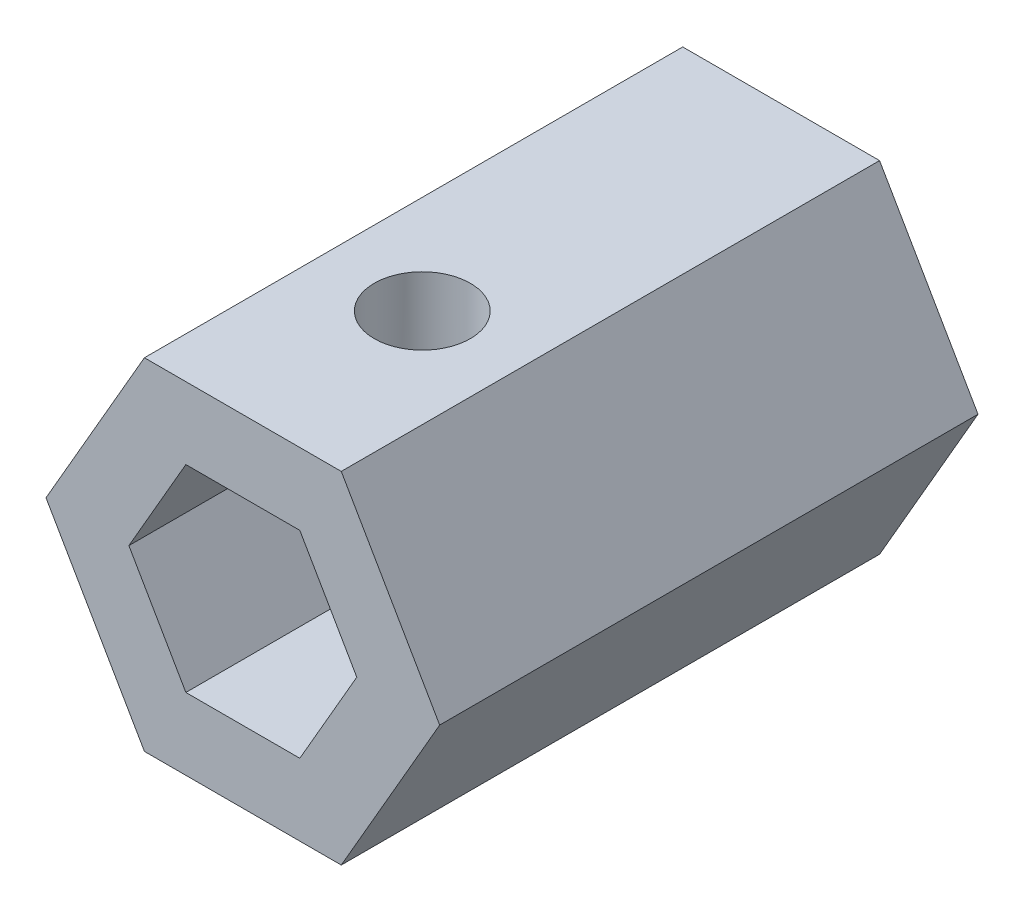
from build123d import *

# Parameters (mm, degrees)
BOSS_EXTRUDE1_DEPTH                       = 2.54
CSK_FOR_8_FLAT_HEAD_MACHINE_SCREW_2_COUNT = 2
CSK_FOR_8_FLAT_HEAD_MACHINE_SCREW_2_PITCH = 18.548356757
BOSS_EXTRUDE2_DEPTH                       = 25.4
M8X1_25_TAPPED_HOLE1_D                    = 6.8
SKETCH6_R                                 = 6.25
BOSS_EXTRUDE3_DEPTH                       = 12.7


with BuildPart() as part:
    # Sketch1 → Boss-Extrude1 (new body)
    with BuildSketch(Plane.XY):
        Polygon((13.931461996, 0), (6.965730998, 12.065), (-6.965730998, 12.065), (-13.931461996, 0), (-6.965730998, -12.065), (6.965730998, -12.065), align=None)
    extrude(amount=BOSS_EXTRUDE1_DEPTH)

    # Sketch3 → CSK for #8 Flat Head Machine Screw (100)1 (revolve, cut)
    with BuildSketch(Plane(origin=(0, 0, 2.54), x_dir=(0, -1, 0), z_dir=(1, 0, 0))):
        Polygon((0, 0), (0, 2.54), (2.2479, 2.54), (2.2479, 1.651767624), (4.2164, 0), align=None)
    csk_for_8_flat_head_machine_screw_100 = revolve(axis=Axis((0, 0, 8.89), (0, 0, -1)), mode=Mode.SUBTRACT)

    # CSK for _8 Flat Head Machine Screw _ 2: CSK for #8 Flat Head Machine Screw (100)1 ×2
    with Locations(*[Vector(-0.9274068813992224, 0.37405410883101997, 0) * (i * CSK_FOR_8_FLAT_HEAD_MACHINE_SCREW_2_PITCH) for i in range(1, CSK_FOR_8_FLAT_HEAD_MACHINE_SCREW_2_COUNT)]):
        add(csk_for_8_flat_head_machine_screw_100, mode=Mode.SUBTRACT)

    # Sketch1<4> → Boss-Extrude2 (add)
    with BuildSketch(Plane.XY):
        Polygon((6.965730998, 12.065), (-6.965730998, 12.065), (-13.931461996, 0), (-6.965730998, -12.065), (6.965730998, -12.065), (13.931461996, 0), align=None)
        Polygon((4.03279163, -6.985), (8.065583261, 0), (4.03279163, 6.985), (-4.03279163, 6.985), (-8.065583261, 0), (-4.03279163, -6.985), align=None, mode=Mode.SUBTRACT)
    extrude(amount=BOSS_EXTRUDE2_DEPTH)

    # M8x1.25 Tapped Hole1 (through all)
    with Locations(Plane(origin=(0, 12.065, 0), x_dir=(1, 0, 0), z_dir=(0, 1, 0))):
        with Locations((0, -12.7)):
            Hole(M8X1_25_TAPPED_HOLE1_D / 2)

    # Sketch6 → Boss-Extrude3 (add)
    with BuildSketch(Plane(origin=(0, 0, 0), x_dir=(-1, 0, 0), z_dir=(0, 0, -1))):
        Polygon((-13.931461996, 0), (-6.965730998, -12.065), (6.965730998, -12.065), (13.931461996, 0), (6.965730998, 12.065), (-6.965730998, 12.065), align=None)
        Circle(SKETCH6_R, mode=Mode.SUBTRACT)
    extrude(amount=BOSS_EXTRUDE3_DEPTH)


solid = part.part
